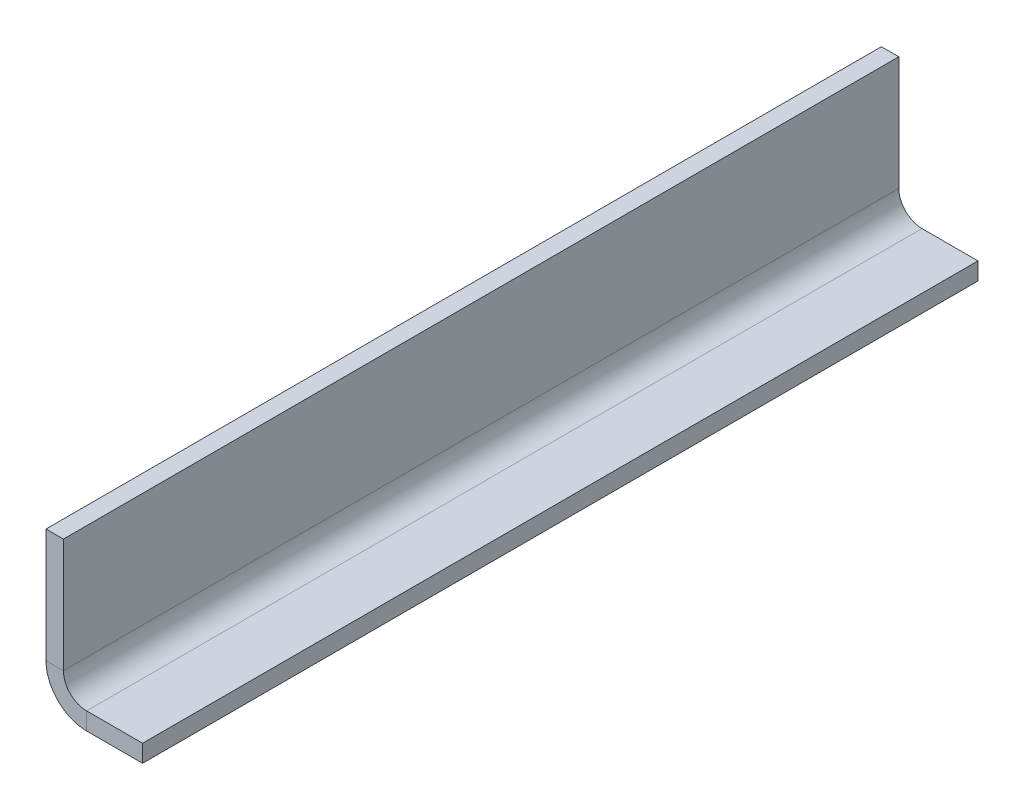
from build123d import *

# Parameters (mm, degrees)
BOSS_EXTRUDE1_DEPTH    = 72
CONVERT_SOLID1_DEPTH   = 72
CONVERT_SOLID1_2_DEPTH = 72


# Read off the part's stored shape, not the designer's step: Convert-Solid1
with BuildPart() as part:
    # Sketch1 → Boss-Extrude1 (new body)
    with BuildSketch(Plane.XY):
        Polygon((0, 15), (0, 0), (10, 0), (10, 3.175), (3.175, 3.175), (3.175, 15), align=None)
    extrude(amount=BOSS_EXTRUDE1_DEPTH)

    # Convert-Solid1 outline → Convert-Solid1 (cut)
    with BuildSketch(Plane.XY):
        with BuildLine():
            Line((1.675, 5.175), (1.675, 15))
            Line((1.675, 15), (0, 15))
            Line((0, 15), (0, 0))
            Line((0, 0), (10, 0))
            Line((10, 0), (10, 1.675))
            Line((10, 1.675), (5.175, 1.675))
            ThreePointArc((5.175, 1.675), (2.700126266, 2.700126266), (1.675, 5.175))
        make_face()
    extrude(amount=CONVERT_SOLID1_DEPTH, mode=Mode.SUBTRACT)

    # Convert-Solid1 2 outline → Convert-Solid1 2 (add)
    with BuildSketch(Plane.XY):
        with BuildLine():
            ThreePointArc((5.175, 3.175), (3.760786438, 3.760786438), (3.175, 5.175))
            Line((3.175, 5.175), (3.175, 3.175))
            Line((3.175, 3.175), (5.175, 3.175))
        make_face()
    extrude(amount=CONVERT_SOLID1_2_DEPTH)


solid = part.part
